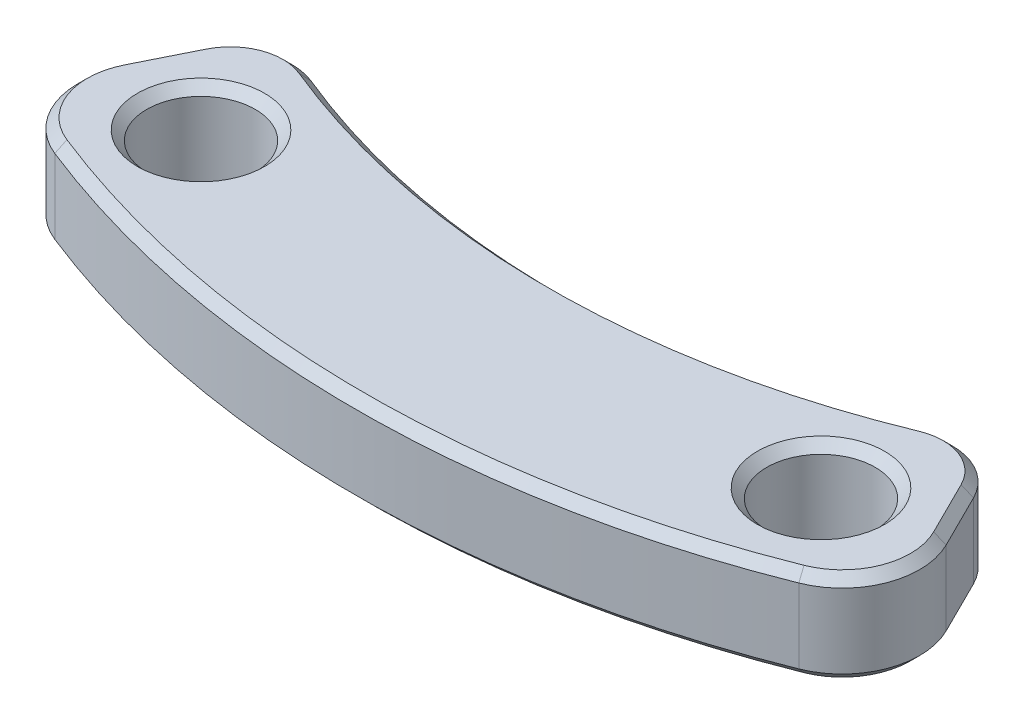
from build123d import *

# Parameters (mm, degrees)
SKETCH_1_R      = 1.75
EXTRUDE_1_DEPTH = 3
CHAMFER_1_SIZE  = 0.3


with BuildPart() as part:
    # 草图1 → 凸台-拉伸1 (new body)
    with BuildSketch(Plane(origin=(0, 0, 0), x_dir=(1, 0, 0), z_dir=(0, 1, 0))):
        with BuildLine():
            Line((-8.058099854, 3.286572102), (-8.934273675, 1.52529864))
            ThreePointArc((-8.934273675, 1.52529864), (-9.030809196, -0.481724252), (-7.6190352, -1.911533393))
            ThreePointArc((-7.6190352, -1.911533393), (4.381181498, -4.208142868), (16.381398197, -1.911533393))
            ThreePointArc((16.381398197, -1.911533393), (17.793172193, -0.481724252), (17.696636672, 1.52529864))
            Line((17.696636672, 1.52529864), (16.820462851, 3.286572102))
            ThreePointArc((16.820462851, 3.286572102), (15.733455475, 4.267905138), (14.26918179, 4.245496696))
            ThreePointArc((14.26918179, 4.245496696), (4.381181498, 2.291857132), (-5.506818793, 4.245496696))
            ThreePointArc((-5.506818793, 4.245496696), (-6.971092478, 4.267905138), (-8.058099854, 3.286572102))
        make_face()
        with Locations((-5.618818502, 0.804359974)):
            Circle(SKETCH_1_R, mode=Mode.SUBTRACT)
        with Locations((14.381181498, 0.804359974)):
            Circle(SKETCH_1_R, mode=Mode.SUBTRACT)
    extrude(amount=EXTRUDE_1_DEPTH)

    # 倒角1
    chamfer_1_edges = [part.edges().sort_by_distance(p)[0] for p in [
        (12.631181498, 0, -0.804359974),
        (12.631181498, 3, -0.804359974),
        (-7.368818502, 0, -0.804359974),
        (-7.368818502, 3, -0.804359974),
        (4.381181498, 0, -2.291857132),
        (-6.971092478, 0, -4.267905138),
        (15.733455475, 0, -4.267905138),
        (-8.496186765, 0, -2.405935371),
        (17.258549762, 0, -2.405935371),
        (-9.030809196, 0, 0.481724252),
        (17.793172193, 0, 0.481724252),
        (4.381181498, 0, 4.208142868),
        (4.381181498, 3, 4.208142868),
        (17.793172193, 3, 0.481724252),
        (-9.030809196, 3, 0.481724252),
        (17.258549762, 3, -2.405935371),
        (-8.496186765, 3, -2.405935371),
        (15.733455475, 3, -4.267905138),
        (-6.971092478, 3, -4.267905138),
        (4.381181498, 3, -2.291857132),
    ]]
    chamfer(chamfer_1_edges, length=CHAMFER_1_SIZE)


solid = part.part
